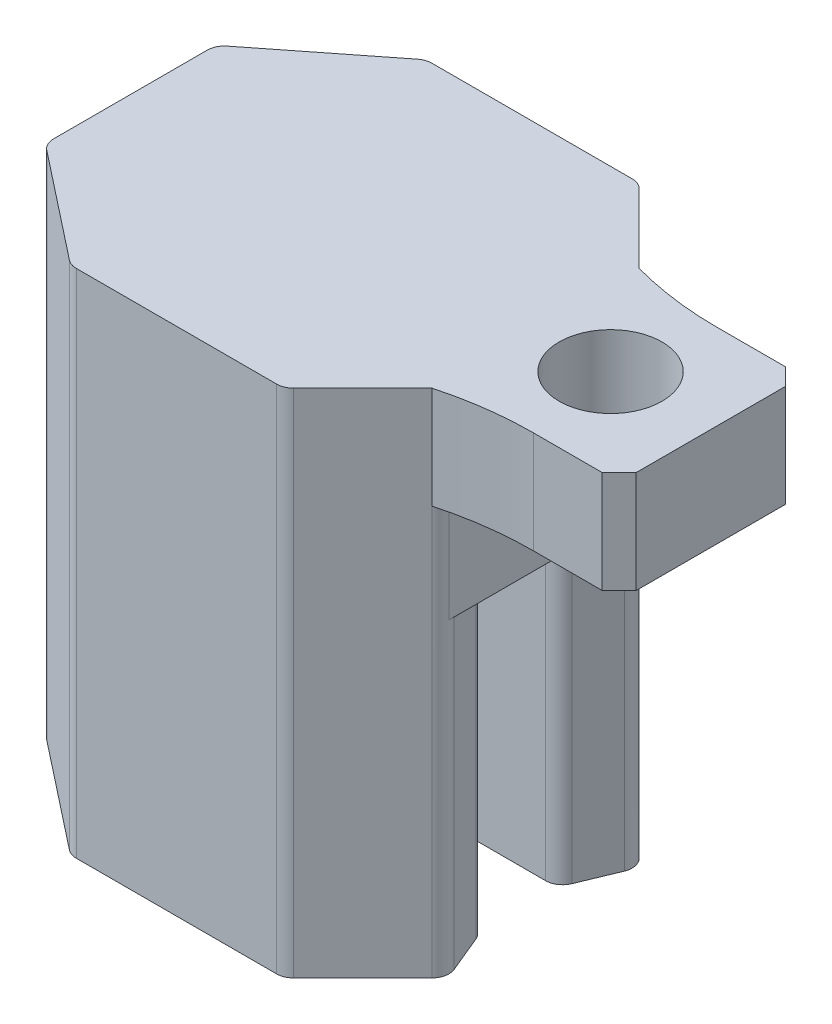
from build123d import *

# Parameters (mm, degrees)
EXTRUDE_1_DEPTH     = 9
EXTRUDE_1_2_DEPTH   = 9
EXTRUDE_2_DEPTH     = 6
SKETCH_7_W          = 5.379535364
SKETCH_7_H          = 3
EXTRUDE_3_DEPTH     = 5
FILLET_1_R          = 10
CHAMFER_1_SIZE      = 0.5
SKETCH_8_R          = 1.51
CUT_EXTRUDE_1_DEPTH = 3


with BuildPart() as part:
    # 草图4 → 凸台-拉伸1 (new body)
    with BuildSketch(Plane(origin=(0, 0, 0), x_dir=(1, 0, 0), z_dir=(0, 1, 0))):
        with BuildLine():
            Line((-5.326508943, 1.1), (4.991869226, 1.1))
            ThreePointArc((4.991869226, 1.1), (5.269632733, 1.184250756), (5.453789099, 1.408610265))
            Line((5.453789099, 1.408610265), (5.90531838, 2.498377946))
            ThreePointArc((5.90531838, 2.498377946), (5.933789047, 2.787323397), (5.796899922, 3.04337304))
            Line((5.796899922, 3.04337304), (3.766484258, 5.073191861))
            ThreePointArc((3.766484258, 5.073191861), (3.604290607, 5.181540331), (3.412982843, 5.219586503))
            Line((3.412982843, 5.219586503), (-2.466960198, 5.219586503))
            ThreePointArc((-2.466960198, 5.219586503), (-2.630617478, 5.19204422), (-2.776244778, 5.112451681))
            Line((-2.776244778, 5.112451681), (-5.905207067, 2.649164418))
            ThreePointArc((-5.905207067, 2.649164418), (-6.092318767, 2.31622196), (-5.989810106, 1.948317839))
            Line((-5.989810106, 1.948317839), (-5.326508943, 1.1))
        make_face()
    extrude(amount=EXTRUDE_1_DEPTH)



with BuildPart() as body_2:
    # 草图4 → Extrude 1 2 (new body)
    with BuildSketch(Plane(origin=(0, 0, 0), x_dir=(1, 0, 0), z_dir=(0, 1, 0))):
        with BuildLine():
            Line((3.766484258, -5.073191861), (5.796899922, -3.04337304))
            ThreePointArc((5.796899922, -3.04337304), (5.933789047, -2.787323397), (5.90531838, -2.498377946))
            Line((5.90531838, -2.498377946), (5.453789099, -1.408610265))
            ThreePointArc((5.453789099, -1.408610265), (5.269632733, -1.184250756), (4.991869226, -1.1))
            Line((4.991869226, -1.1), (-5.326508943, -1.1))
            Line((-5.326508943, -1.1), (-5.989810106, -1.948317839))
            ThreePointArc((-5.989810106, -1.948317839), (-6.092318767, -2.31622196), (-5.905207067, -2.649164418))
            Line((-5.905207067, -2.649164418), (-2.776244778, -5.112451681))
            ThreePointArc((-2.776244778, -5.112451681), (-2.630617478, -5.19204422), (-2.466960198, -5.219586503))
            Line((-2.466960198, -5.219586503), (3.412982843, -5.219586503))
            ThreePointArc((3.412982843, -5.219586503), (3.604290607, -5.181540331), (3.766484258, -5.073191861))
        make_face()
    extrude(amount=EXTRUDE_1_2_DEPTH)


with BuildPart() as part_1:
    add(part.part)

    add(body_2.part)  # 凸台-拉伸2 merges body 2
    # 草图5 → 凸台-拉伸2 (add)
    with BuildSketch(Plane(origin=(0, 9, 0), x_dir=(1, 0, 0), z_dir=(0, 1, 0))):
        with BuildLine():
            Line((3.766484258, -5.073191861), (5.796899922, -3.04337304))
            ThreePointArc((5.796899922, -3.04337304), (5.905324208, -2.881143349), (5.943398507, -2.689767682))
            Line((5.943398507, -2.689767682), (5.943398507, 2.689767682))
            ThreePointArc((5.943398507, 2.689767682), (5.905324208, 2.881143349), (5.796899922, 3.04337304))
            Line((5.796899922, 3.04337304), (3.766484258, 5.073191861))
            ThreePointArc((3.766484258, 5.073191861), (3.604290607, 5.181540331), (3.412982843, 5.219586503))
            Line((3.412982843, 5.219586503), (-2.466960198, 5.219586503))
            ThreePointArc((-2.466960198, 5.219586503), (-2.630617478, 5.19204422), (-2.776244778, 5.112451681))
            Line((-2.776244778, 5.112451681), (-5.905207067, 2.649164418))
            ThreePointArc((-5.905207067, 2.649164418), (-6.045723715, 2.474654122), (-6.095922486, 2.256299239))
            Line((-6.095922486, 2.256299239), (-6.095922486, -2.256299239))
            ThreePointArc((-6.095922486, -2.256299239), (-6.045723715, -2.474654122), (-5.905207067, -2.649164418))
            Line((-5.905207067, -2.649164418), (-2.776244778, -5.112451681))
            ThreePointArc((-2.776244778, -5.112451681), (-2.630617478, -5.19204422), (-2.466960198, -5.219586503))
            Line((-2.466960198, -5.219586503), (3.412982843, -5.219586503))
            ThreePointArc((3.412982843, -5.219586503), (3.604290607, -5.181540331), (3.766484258, -5.073191861))
        make_face()
    extrude(amount=EXTRUDE_2_DEPTH)

    # 草图7 → 凸台-拉伸3 (add)
    with BuildSketch(Plane(origin=(5.943398507, 0, 0), x_dir=(0, 0, -1), z_dir=(1, 0, 0))):
        with Locations((0, 13.5)):
            Rectangle(SKETCH_7_W, SKETCH_7_H)
    extrude(amount=EXTRUDE_3_DEPTH)

    # 圆角1
    # the kernel refuses this fillet: 10 mm, written as the material it adds along each edge
    with BuildSketch(Plane(origin=(5.943398507, 12, -2.689767682), x_dir=(-0.38275133514604787, 0, -0.923851403334929), z_dir=(0, 1, 0))) as fillet_1_piece_1:
        with BuildLine():
            CenterArc((8.285757547, -6.127192899), FILLET_1_R, 142.213613886, 15.282174956)
            Line((-0.952756487, -2.299679547), (0, 0))
            ThreePointArc((0, 0), (0.191375668, -0.038074298), (0.382751335, 0))
        make_face()
    extrude(amount=3)
    with BuildSketch(Plane(origin=(5.943398507, 12, 2.689767682), x_dir=(-0.3827513351460759, 0, 0.9238514033349174), z_dir=(0, 1, 0))) as fillet_1_piece_2:
        with BuildLine():
            CenterArc((8.285757547, 6.127192899), FILLET_1_R, 202.504211157, 15.282174956)
            Line((-0.952756487, 2.299679547), (0, 0))
            ThreePointArc((0, 0), (0.191375668, 0.038074298), (0.382751335, 0))
        make_face()
    extrude(amount=3)

    # 倒角1
    chamfer_1_edges = [part_1.edges().sort_by_distance(p)[0] for p in [
        (10.943398507, 13.5, -2.689767682),
        (10.943398507, 13.5, 2.689767682),
    ]]
    chamfer(chamfer_1_edges, length=CHAMFER_1_SIZE)

    # 草图8 → 切除-拉伸1 (cut)
    with BuildSketch(Plane(origin=(0, 15, 0), x_dir=(1, 0, 0), z_dir=(0, 1, 0))):
        with Locations(Location((8, 0, 0), (0, 0, 270))):
            Circle(SKETCH_8_R)
    extrude(amount=-CUT_EXTRUDE_1_DEPTH, mode=Mode.SUBTRACT)


solid = part_1.part
